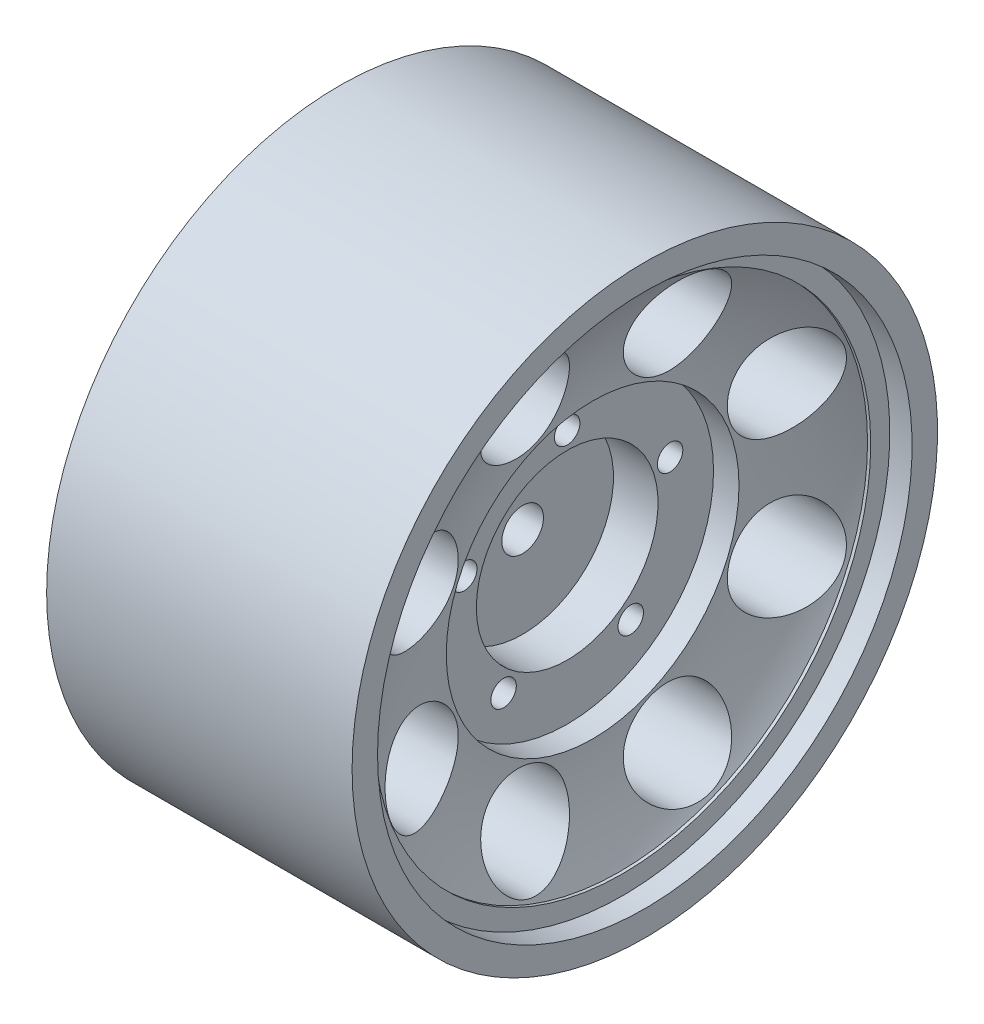
from build123d import *

# Parameters (mm, degrees)
CUT_EXTRUDE2_DEPTH      = 38.248120758
CUT_EXTRUDE2_DEPTH_BACK = 38.248120758
SKETCH2_R               = 3.75
CUT_EXTRUDE3_REACH      = 39.127
SKETCH3_R               = 1
CUT_EXTRUDE4_DEPTH      = 6.148


with BuildPart() as part:
    # Sketch1 → Revolve1 (revolve)
    with BuildSketch(Plane(origin=(0, 0, 0), x_dir=(1, 0, 0), z_dir=(0, 1, 0))):
        with BuildLine():
            Line((8.55, 1.6383), (8.55, 7.1383))
            Line((8.55, 7.1383), (12.05, 7.1383))
            Line((12.05, 7.1383), (12.05, 11.5))
            Line((12.05, 11.5), (14.05, 11.5))
            ThreePointArc((14.05, 11.5), (14.583745157, 15.635516896), (16.15, 19.5))
            Line((16.15, 19.5), (16.4, 19.5))
            Line((16.4, 19.5), (16.4, 21))
            Line((16.4, 21), (18.15, 21))
            Line((18.15, 21), (18.15, 23))
            Line((18.15, 23), (-5.85, 23))
            Line((-5.85, 23), (-5.85, 21))
            Line((-5.85, 21), (-4.35, 19.5))
            Line((-4.35, 19.5), (7, 19.5))
            Line((7, 19.5), (7, 9.75))
            Line((7, 9.75), (0, 9.75))
            Line((0, 9.75), (0, 1.6383))
            Line((0, 1.6383), (8.55, 1.6383))
        make_face()
    revolve(axis=Axis((0, 0, 0), (1, 0, 0)))

    # Sketch2 → Cut-Extrude2 (cut, two sides: drawn at the far end of the back side and taken through both)
    with BuildSketch(Plane(origin=(0, 0, 0), x_dir=(0, 0, -1), z_dir=(1, 0, 0)).offset(-CUT_EXTRUDE2_DEPTH_BACK)):
        with Locations((-5.931593202, 14.320132754)):
            Circle(SKETCH2_R)
        with Locations((5.931593202, 14.320132754)):
            Circle(SKETCH2_R)
        with Locations((14.320132754, 5.931593202)):
            Circle(SKETCH2_R)
        with Locations((14.320132754, -5.931593202)):
            Circle(SKETCH2_R)
        with Locations((5.931593202, -14.320132754)):
            Circle(SKETCH2_R)
        with Locations((-5.931593202, -14.320132754)):
            Circle(SKETCH2_R)
        with Locations((-14.320132754, -5.931593202)):
            Circle(SKETCH2_R)
        with Locations((-14.320132754, 5.931593202)):
            Circle(SKETCH2_R)
    extrude(amount=CUT_EXTRUDE2_DEPTH + CUT_EXTRUDE2_DEPTH_BACK, mode=Mode.SUBTRACT)

    # Sketch3 → Cut-Extrude3 (cut, up to next)
    with BuildSketch(Plane(origin=(12.05, 0, 0), x_dir=(0, 0, -1), z_dir=(1, 0, 0)), mode=Mode.PRIVATE) as cut_extrude3_sk1:
        with Locations((0, 8.5)):
            Circle(SKETCH3_R)
    cut_extrude3_tool1 = extrude(cut_extrude3_sk1.sketch, amount=-CUT_EXTRUDE3_REACH, mode=Mode.PRIVATE) & part.part
    # Sketch3 → Cut-Extrude3 (cut, up to next)
    with BuildSketch(Plane(origin=(12.05, 0, 0), x_dir=(0, 0, -1), z_dir=(1, 0, 0)), mode=Mode.PRIVATE) as cut_extrude3_sk2:
        with Locations((8.083980389, 2.626644452)):
            Circle(SKETCH3_R)
    cut_extrude3_tool2 = extrude(cut_extrude3_sk2.sketch, amount=-CUT_EXTRUDE3_REACH, mode=Mode.PRIVATE) & part.part
    # Sketch3 → Cut-Extrude3 (cut, up to next)
    with BuildSketch(Plane(origin=(12.05, 0, 0), x_dir=(0, 0, -1), z_dir=(1, 0, 0)), mode=Mode.PRIVATE) as cut_extrude3_sk3:
        with Locations((4.996174644, -6.876644452)):
            Circle(SKETCH3_R)
    cut_extrude3_tool3 = extrude(cut_extrude3_sk3.sketch, amount=-CUT_EXTRUDE3_REACH, mode=Mode.PRIVATE) & part.part
    # Sketch3 → Cut-Extrude3 (cut, up to next)
    with BuildSketch(Plane(origin=(12.05, 0, 0), x_dir=(0, 0, -1), z_dir=(1, 0, 0)), mode=Mode.PRIVATE) as cut_extrude3_sk4:
        with Locations((-4.996174644, -6.876644452)):
            Circle(SKETCH3_R)
    cut_extrude3_tool4 = extrude(cut_extrude3_sk4.sketch, amount=-CUT_EXTRUDE3_REACH, mode=Mode.PRIVATE) & part.part
    # Sketch3 → Cut-Extrude3 (cut, up to next)
    with BuildSketch(Plane(origin=(12.05, 0, 0), x_dir=(0, 0, -1), z_dir=(1, 0, 0)), mode=Mode.PRIVATE) as cut_extrude3_sk5:
        with Locations((-8.083980389, 2.626644452)):
            Circle(SKETCH3_R)
    cut_extrude3_tool5 = extrude(cut_extrude3_sk5.sketch, amount=-CUT_EXTRUDE3_REACH, mode=Mode.PRIVATE) & part.part
    add(cut_extrude3_tool1.solids().sort_by_distance((12.05, 8.5, 0))[0], mode=Mode.SUBTRACT)
    add(cut_extrude3_tool2.solids().sort_by_distance((12.05, 2.626644, -8.08398))[0], mode=Mode.SUBTRACT)
    add(cut_extrude3_tool3.solids().sort_by_distance((12.05, -6.876644, -4.996175))[0], mode=Mode.SUBTRACT)
    add(cut_extrude3_tool4.solids().sort_by_distance((12.05, -6.876644, 4.996175))[0], mode=Mode.SUBTRACT)
    add(cut_extrude3_tool5.solids().sort_by_distance((12.05, 2.626644, 8.08398))[0], mode=Mode.SUBTRACT)

    # Sketch4 → Cut-Extrude4 (cut)
    with BuildSketch(Plane.ZY):
        Polygon((6.92820323, 0), (3.464101615, 6), (-3.464101615, 6), (-6.92820323, 0), (-3.464101615, -6), (3.464101615, -6), align=None)
    extrude(amount=-CUT_EXTRUDE4_DEPTH, mode=Mode.SUBTRACT)


solid = part.part
